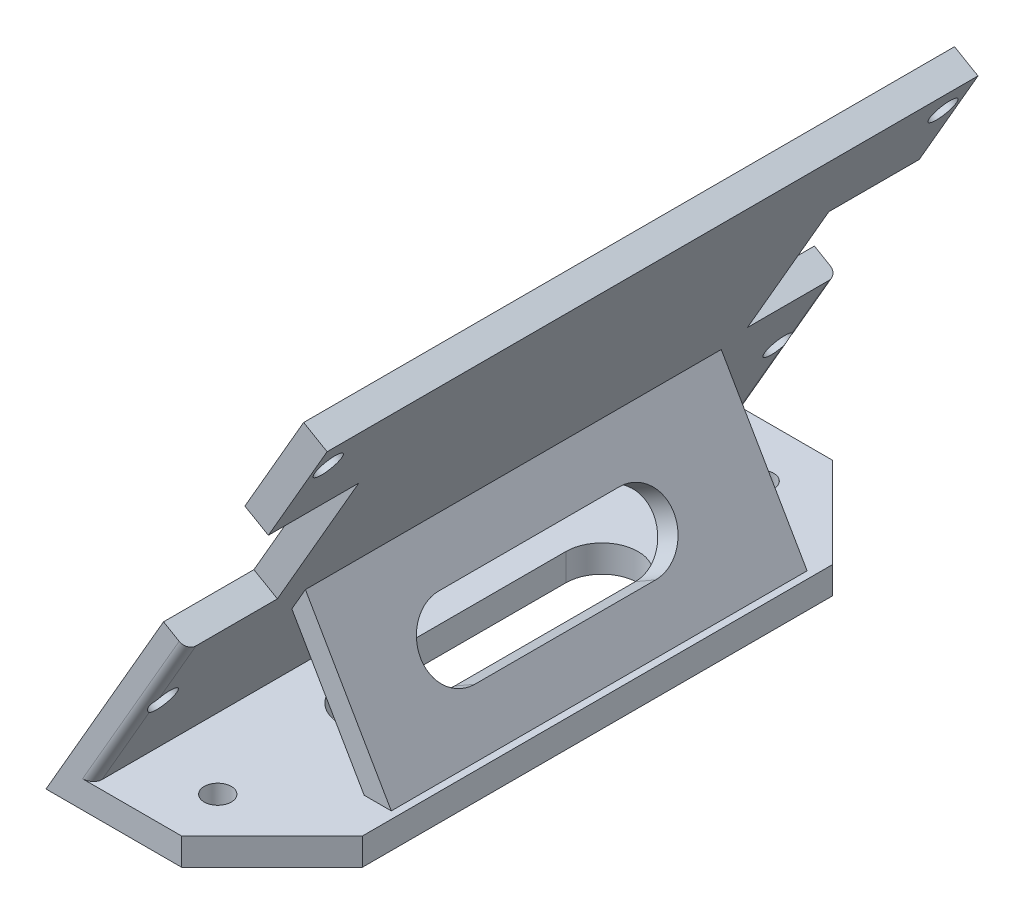
from build123d import *

# Parameters (mm, degrees)
EXTRUDE_1_DEPTH      = 36
EXTRUDE_1_DEPTH_BACK = 36
EXTRUDE_2_DEPTH      = 60
SKETCH_4_R           = 1.5
SKETCH_4_W           = 10
SKETCH_4_H           = 18
CUT_EXTRUDE_1_DEPTH  = 6
CUT_EXTRUDE_3_DEPTH  = 14
SKETCH_9_R           = 1.5
CUT_EXTRUDE_5_DEPTH  = 6
CUT_EXTRUDE_6_DEPTH  = 3
FILLET_1_R           = 1
CHAMFER_1_SIZE       = 10


with BuildPart() as part:
    # 草图2 → 凸台-拉伸1 (new, two sides: drawn at the far end of the back side and taken through both)
    with BuildSketch(Plane.XY.offset(-EXTRUDE_1_DEPTH_BACK)):
        Polygon((0, 0), (28.5, 49.363448016), (31.098076211, 47.863448016), (5.196152423, 3), (25, 3), (25, 0), align=None)
    extrude(amount=EXTRUDE_1_DEPTH + EXTRUDE_1_DEPTH_BACK)

    # 草图3 → 凸台-拉伸2 (add)
    with BuildSketch(Plane.XY.offset(36)):
        Polygon((13.196152423, 16.856406461), (14.696152423, 19.454482672), (24.196152423, 3), (21.196152423, 3), align=None)
    extrude(amount=-EXTRUDE_2_DEPTH)

    # 草图4 → 切除-拉伸1 (cut)
    with BuildSketch(Plane(origin=(0, 0, 0), x_dir=(0, 0, 1), z_dir=(-0.8660254037844365, 0.500000000000004, 0))):
        with Locations(Location((34, 53.25, 0), (0, 0, 270))):
            Circle(SKETCH_4_R)
        with Locations(Location((34, 16.75, 0), (0, 0, 90))):
            Circle(SKETCH_4_R)
        with Locations(Location((-34, 16.75, 0), (0, 0, 270))):
            Circle(SKETCH_4_R)
        with Locations(Location((-34, 53.25, 0), (0, 0, 90))):
            Circle(SKETCH_4_R)
        with Locations((31, 35)):
            Rectangle(SKETCH_4_W, SKETCH_4_H)
        with Locations((-31, 35)):
            Rectangle(SKETCH_4_W, SKETCH_4_H)
    extrude(amount=-CUT_EXTRUDE_1_DEPTH, mode=Mode.SUBTRACT)

    # 草图6 → 切除-拉伸3 (cut)
    with BuildSketch(Plane.XY.offset(36)):
        Polygon((24.196152423, 3), (14.696152423, 19.454482672), (13.196152423, 16.856406461), (21.196152423, 3), align=None)
    extrude(amount=-CUT_EXTRUDE_3_DEPTH, mode=Mode.SUBTRACT)

    # 草图9 → 切除-拉伸5 (cut)
    with BuildSketch(Plane.XZ):
        with Locations(Location((13, 30, 0), (0, 0, 270))):
            Circle(SKETCH_9_R)
        with Locations(Location((13, -30, 0), (0, 0, 90))):
            Circle(SKETCH_9_R)
        with BuildLine():
            Line((9, -12.5), (9, 12.5))
            ThreePointArc((9, 12.5), (13, 16.5), (17, 12.5))
            Line((17, 12.5), (17, -12.5))
            ThreePointArc((17, -12.5), (13, -16.5), (9, -12.5))
        make_face()
    extrude(amount=-CUT_EXTRUDE_5_DEPTH, mode=Mode.SUBTRACT)

    # 草图11 → 切除-拉伸6 (cut)
    with BuildSketch(Plane(origin=(19.446152423, 11.227241336, 0), x_dir=(0, 0, -1), z_dir=(0.8660254037844374, 0.5000000000000022, 0))):
        with BuildLine():
            Line((-10, 4), (10, 4))
            ThreePointArc((10, 4), (14, 0), (10, -4))
            Line((10, -4), (-10, -4))
            ThreePointArc((-10, -4), (-14, 0), (-10, 4))
        make_face()
    extrude(amount=-CUT_EXTRUDE_6_DEPTH, mode=Mode.SUBTRACT)

    # 圆角1
    # the kernel refuses this fillet: 1 mm, written as the material it takes off along each edge
    with BuildSketch(Plane(origin=(16.848076211, 23.181724008, -36), x_dir=(-0.8660254037844364, 0.500000000000004, 0), z_dir=(-0.5000000000000039, -0.8660254037844364, 0))) as fillet_1_piece_1_section:
        with BuildLine():
            CenterArc((FILLET_1_R, -FILLET_1_R), FILLET_1_R, 90, 90)
            Line((0, -FILLET_1_R), (0, 0))
            Line((0, 0), (FILLET_1_R, 0))
        make_face()
    fillet_1_piece_1 = extrude(amount=25.803847577, mode=Mode.PRIVATE)
    fillet_1_piece_1 = split(fillet_1_piece_1, bisect_by=Plane(origin=(10.79221618, 3, -35.774281329), z_dir=(0, 1, 0)), keep=Keep.TOP, mode=Mode.PRIVATE)
    add(fillet_1_piece_1, mode=Mode.SUBTRACT)
    with BuildSketch(Plane(origin=(3.946152423, 0.834936491, 36), x_dir=(-0.8660254037844366, 0.5000000000000037, 0), z_dir=(0.5000000000000037, 0.8660254037844366, 0))) as fillet_1_piece_2_section:
        with BuildLine():
            CenterArc((FILLET_1_R, -FILLET_1_R), FILLET_1_R, 90, 90)
            Line((0, -FILLET_1_R), (0, 0))
            Line((0, 0), (FILLET_1_R, 0))
        make_face()
    fillet_1_piece_2 = extrude(amount=25.803847577, mode=Mode.PRIVATE)
    fillet_1_piece_2 = split(fillet_1_piece_2, bisect_by=Plane(origin=(10.79221618, 3, 35.774281329), z_dir=(0, 1, 0)), keep=Keep.TOP, mode=Mode.PRIVATE)
    add(fillet_1_piece_2, mode=Mode.SUBTRACT)

    # 倒角1
    chamfer_1_edges = [part.edges().sort_by_distance(p)[0] for p in [
        (25, 1.5, 36),
        (25, 1.5, -36),
    ]]
    chamfer(chamfer_1_edges, length=CHAMFER_1_SIZE)


solid = part.part
